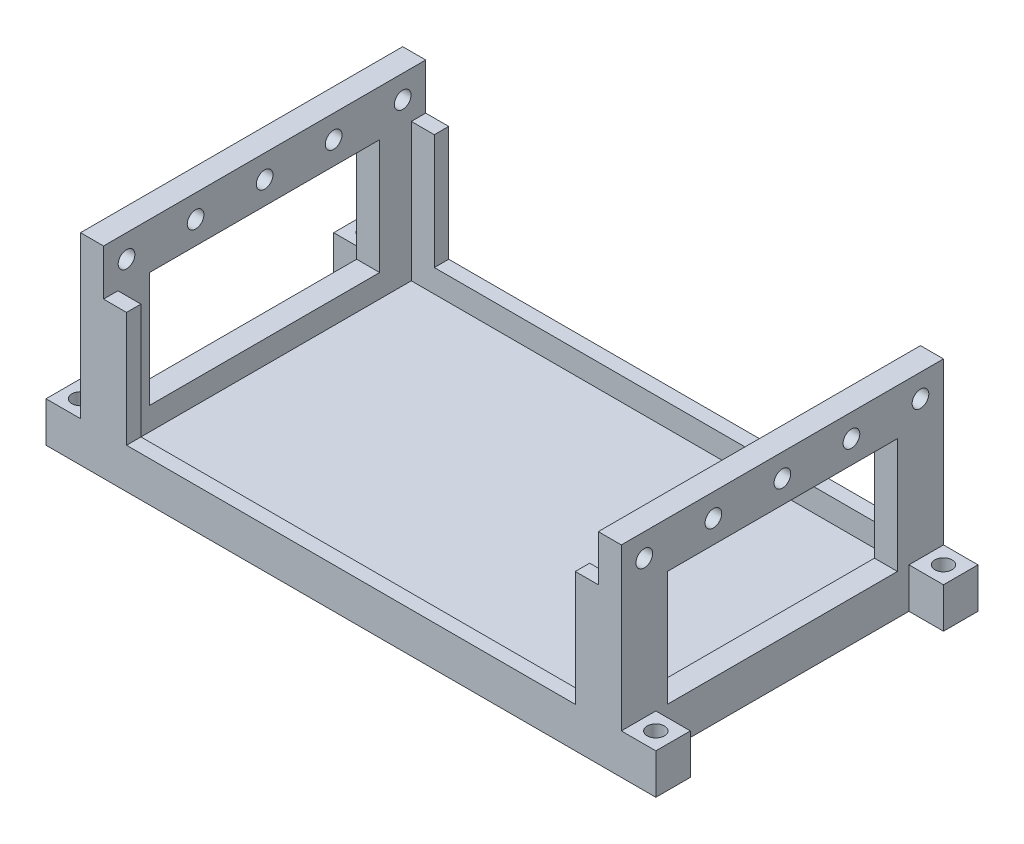
from build123d import *

# Parameters (mm, degrees)
SKETCH1_R           = 1.5
BOSS_EXTRUDE1_DEPTH = 3
SKETCH2_R           = 1.5
SKETCH2_W           = 86
SKETCH2_H           = 51
BOSS_EXTRUDE2_DEPTH = 4
BOSS_EXTRUDE3_DEPTH = 20
SKETCH4_W           = 4
SKETCH4_H           = 56
BOSS_EXTRUDE4_DEPTH = 8
SKETCH5_R           = 1.45
CUT_EXTRUDE1_DEPTH  = 120.837389825


with BuildPart() as part:
    # Sketch1 → Boss-Extrude1 (new body)
    with BuildSketch(Plane(origin=(0, 0, 0), x_dir=(1, 0, 0), z_dir=(0, 1, 0))):
        Polygon((0, 0), (94, 0), (100, 0), (100, 6), (94, 6), (94, 50), (100, 50), (100, 56), (94, 56), (0, 56), (-6, 56), (-6, 50), (0, 50), (0, 6), (-6, 6), (-6, 0), align=None)
        with Locations((-3, 53)):
            Circle(SKETCH1_R, mode=Mode.SUBTRACT)
        with Locations((97, 53)):
            Circle(SKETCH1_R, mode=Mode.SUBTRACT)
        with Locations((97, 3)):
            Circle(SKETCH1_R, mode=Mode.SUBTRACT)
        with Locations((-3, 3)):
            Circle(SKETCH1_R, mode=Mode.SUBTRACT)
    extrude(amount=BOSS_EXTRUDE1_DEPTH)

    # Sketch2 → Boss-Extrude2 (add)
    with BuildSketch(Plane(origin=(0, 3, 0), x_dir=(1, 0, 0), z_dir=(0, 1, 0))):
        Polygon((0, 50), (0, 6), (-6, 6), (-6, 0), (100, 0), (100, 6), (94, 6), (94, 50), (100, 50), (100, 56), (-6, 56), (-6, 50), align=None)
        with Locations((-3, 53)):
            Circle(SKETCH2_R, mode=Mode.SUBTRACT)
        with Locations((97, 53)):
            Circle(SKETCH2_R, mode=Mode.SUBTRACT)
        with Locations((97, 3)):
            Circle(SKETCH2_R, mode=Mode.SUBTRACT)
        with Locations((-3, 3)):
            Circle(SKETCH2_R, mode=Mode.SUBTRACT)
        with Locations((47, 28)):
            Rectangle(SKETCH2_W, SKETCH2_H, mode=Mode.SUBTRACT)
    extrude(amount=BOSS_EXTRUDE2_DEPTH)

    # Sketch3 → Boss-Extrude3 (add)
    with BuildSketch(Plane(origin=(0, 7, 0), x_dir=(1, 0, 0), z_dir=(0, 1, 0))):
        Polygon((8, 56), (0, 56), (0, 48), (4, 48), (4, 53.5), (8, 53.5), align=None)
        Polygon((94, 56), (86, 56), (86, 53.5), (90, 53.5), (90, 48), (94, 48), align=None)
        Polygon((4, 2.5), (4, 8), (0, 8), (0, 0), (8, 0), (8, 2.5), align=None)
        Polygon((94, 8), (90, 8), (90, 2.5), (86, 2.5), (86, 0), (94, 0), align=None)
    extrude(amount=BOSS_EXTRUDE3_DEPTH)

    # Sketch4 → Boss-Extrude4 (add)
    with BuildSketch(Plane(origin=(0, 27, 0), x_dir=(1, 0, 0), z_dir=(0, 1, 0))):
        with Locations((2, 28)):
            Rectangle(SKETCH4_W, SKETCH4_H)
        with Locations((92, 28)):
            Rectangle(SKETCH4_W, SKETCH4_H)
    extrude(amount=BOSS_EXTRUDE4_DEPTH)

    # Sketch5 → Cut-Extrude1 (cut, through all)
    with BuildSketch(Plane.ZY):
        with Locations((-52, 31)):
            Circle(SKETCH5_R)
        with Locations((-40, 31)):
            Circle(SKETCH5_R)
        with Locations((-28, 31)):
            Circle(SKETCH5_R)
        with Locations((-16, 31)):
            Circle(SKETCH5_R)
        with Locations((-4, 31)):
            Circle(SKETCH5_R)
    extrude(amount=-CUT_EXTRUDE1_DEPTH, mode=Mode.SUBTRACT)


solid = part.part
